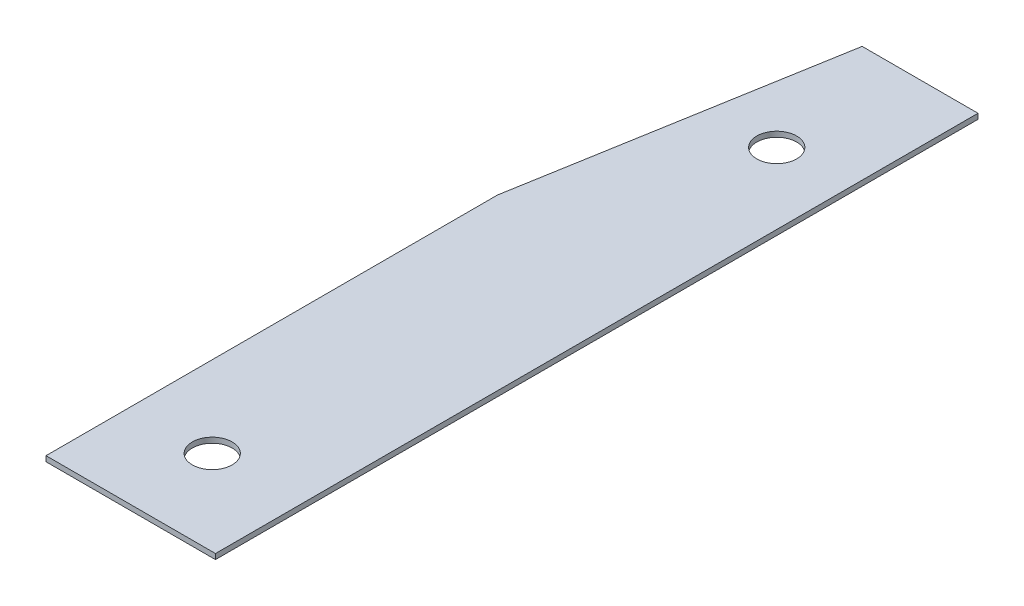
from build123d import *

# Parameters (mm, degrees)
SKETCH1_R           = 5.969
BOSS_EXTRUDE1_DEPTH = 1.5875


with BuildPart() as part:
    # Sketch1 → Boss-Extrude1 (new body)
    with BuildSketch(Plane(origin=(0, 0, 0), x_dir=(1, 0, 0), z_dir=(0, 1, 0))):
        Polygon((50.8, 228.6), (16.073027172, 228.6), (0, 135.362739137), (0, 0), (50.8, 0), align=None)
        with Locations((24.327009544, 25.509186042)):
            Circle(SKETCH1_R, mode=Mode.SUBTRACT)
        with Locations((29.504213454, 189.557234372)):
            Circle(SKETCH1_R, mode=Mode.SUBTRACT)
    extrude(amount=BOSS_EXTRUDE1_DEPTH)


solid = part.part
